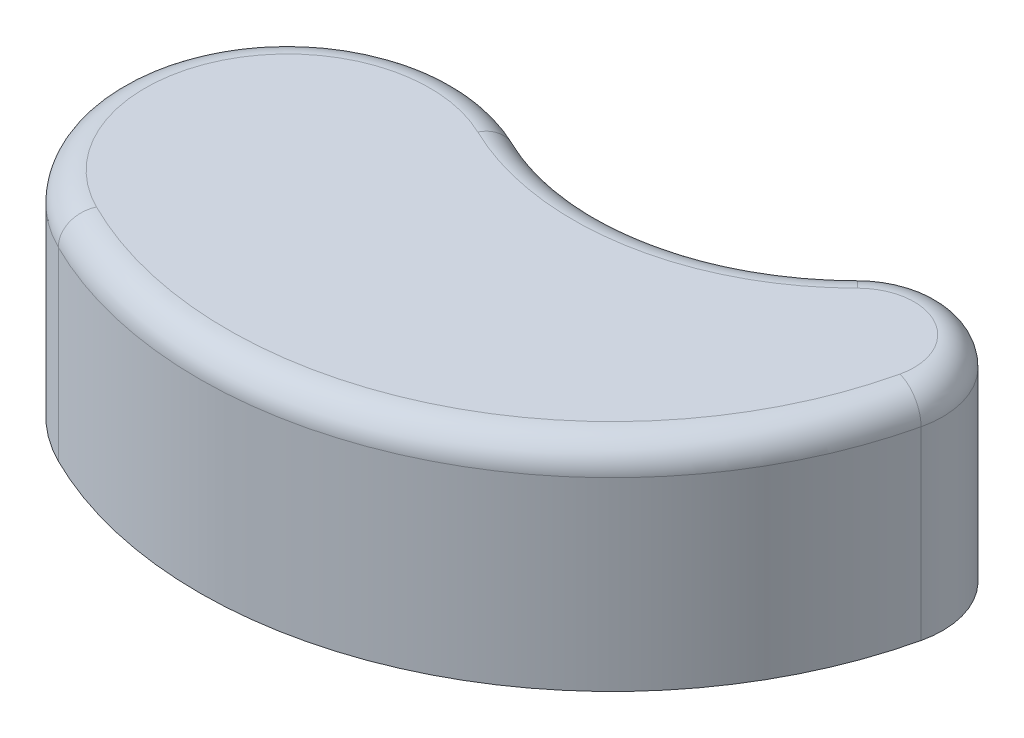
from build123d import *

# Parameters (mm, degrees)
BOSS_EXTRUDE1_DEPTH = 75
FILLET1_R           = 10


# Read off the part's stored shape, not the designer's step: Boss-Extrude1
with BuildPart() as part:
    # Boss-Extrude1 outline → Boss-Extrude1 (new body)
    with BuildSketch(Plane(origin=(0, 0, 0), x_dir=(1, 0, 0), z_dir=(0, 1, 0))):
        with BuildLine():
            ThreePointArc((179.220822611, 43.207097385), (164.591443385, 76.212397447), (128.83092118, 71.25723646))
            ThreePointArc((128.83092118, 71.25723646), (80.227844704, 46.271602396), (26.129473888, 54.011578336))
            ThreePointArc((26.129473888, 54.011578336), (-53.844334239, 26.472394497), (-26.8142447, -53.674912959))
            ThreePointArc((-26.8142447, -53.674912959), (99.687960456, -55.177812298), (179.220822611, 43.207097385))
        make_face()
    extrude(amount=BOSS_EXTRUDE1_DEPTH)

    # Fillet1
    fillet1_edges = [part.edges().sort_by_distance(p)[0] for p in [
        (99.687960456, 75, 55.177812298),
        (164.591443385, 75, -76.212397447),
        (80.227844704, 75, -46.271602396),
        (-53.844334239, 75, -26.472394497),
    ]]
    fillet(fillet1_edges, radius=FILLET1_R)


solid = part.part
